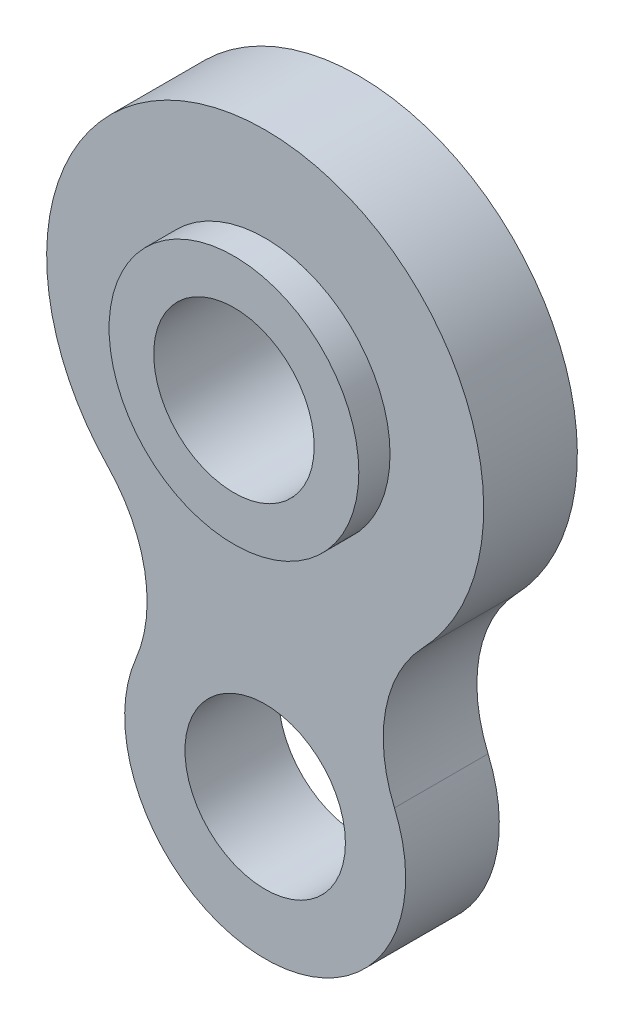
from build123d import *

# Parameters (mm, degrees)
SKETCH2_R           = 3.175
SKETCH2_R_2         = 2.0399375
BOSS_EXTRUDE1_DEPTH = 2.38125
SKETCH2_6_R         = 3.175
SKETCH2_6_R_2       = 2.0399375
BOSS_EXTRUDE2_DEPTH = 3.175


with BuildPart() as part:
    # Sketch2 → Boss-Extrude1 (new body)
    with BuildSketch(Plane.XY):
        with BuildLine():
            ThreePointArc((4.001636324, -3.8547141), (3.3e-08, 5.55625), (-4.001636369, -3.854714053))
            ThreePointArc((-4.001636369, -3.854714053), (-3.061446657, -5.68510333), (-3.28705844, -7.730434825))
            ThreePointArc((-3.28705844, -7.730434825), (3.2e-08, -12.7), (3.287058415, -7.730434766))
            ThreePointArc((3.287058415, -7.730434766), (3.061446657, -5.685103331), (4.001636324, -3.8547141))
        make_face()
        Circle(SKETCH2_R, mode=Mode.SUBTRACT)
        with Locations((0, -9.128125)):
            Circle(SKETCH2_R_2, mode=Mode.SUBTRACT)
    extrude(amount=BOSS_EXTRUDE1_DEPTH)

    # Sketch2<6> → Boss-Extrude2 (add)
    with BuildSketch(Plane.XY):
        Circle(SKETCH2_6_R)
        Circle(SKETCH2_6_R_2, mode=Mode.SUBTRACT)
    extrude(amount=BOSS_EXTRUDE2_DEPTH)


solid = part.part
